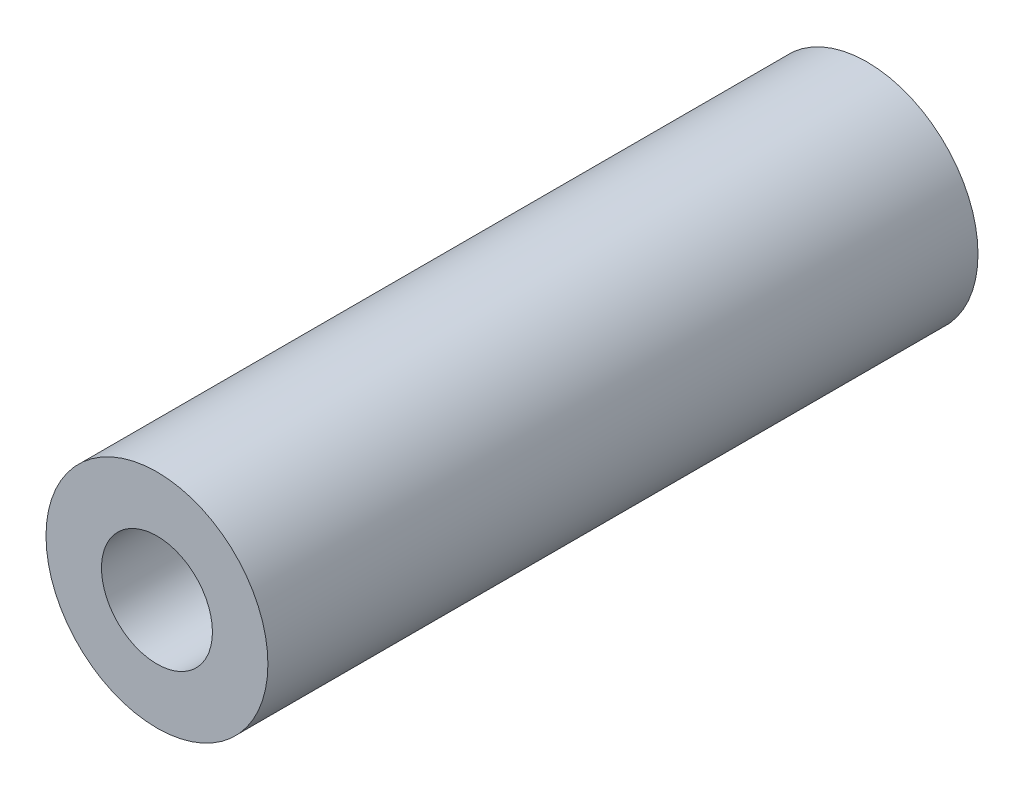
from build123d import *

# Parameters (mm, degrees)
SKETCH_1_R      = 2.5
SKETCH_1_R_2    = 1.25
EXTRUDE_1_DEPTH = 16


with BuildPart() as part:
    # 草图1 → 凸台-拉伸1 (new body)
    with BuildSketch(Plane.XY):
        Circle(SKETCH_1_R)
        Circle(SKETCH_1_R_2, mode=Mode.SUBTRACT)
    extrude(amount=EXTRUDE_1_DEPTH)


solid = part.part
